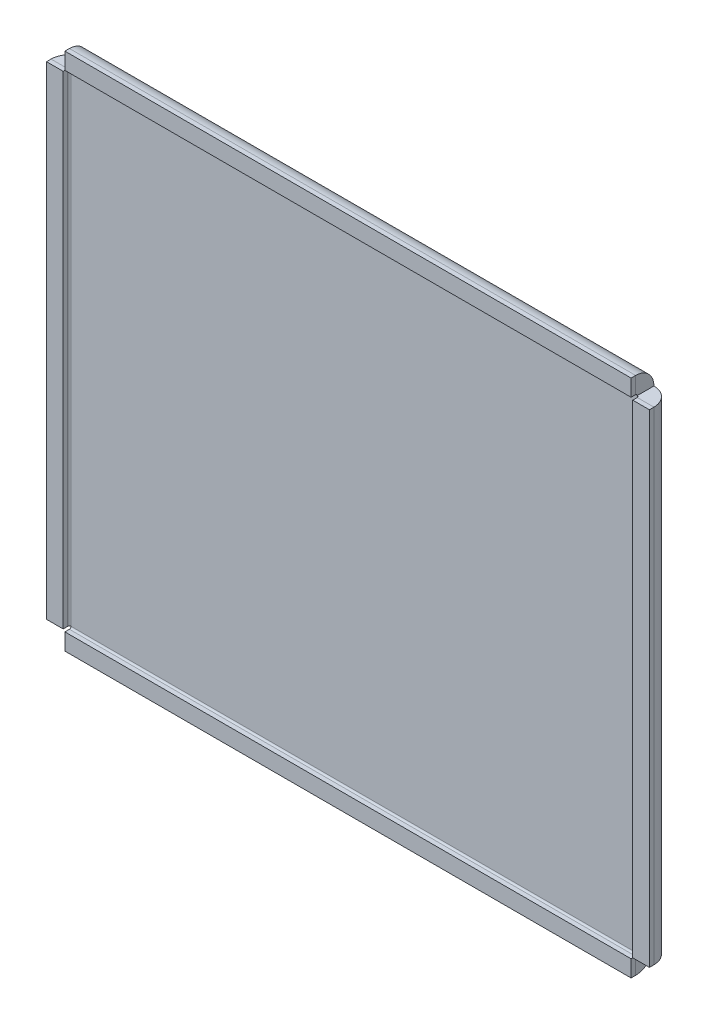
from build123d import *

# Parameters (mm, degrees)
SKETCH1_W          = 431.8
SKETCH1_H          = 368.3
BASE_FLANGE1_DEPTH = 12.7
EDGE_FLANGE1_DEPTH = 431.8
EDGE_FLANGE2_DEPTH = 431.8
EDGE_FLANGE3_DEPTH = 368.3
EDGE_FLANGE4_DEPTH = 368.3


# Sheet-metal steps are written as plain solids
with BuildPart() as part:
    # Sketch1 → Base-Flange1 (new body)
    with BuildSketch(Plane.XY):
        Rectangle(SKETCH1_W, SKETCH1_H)
    extrude(amount=BASE_FLANGE1_DEPTH)

    # Edge-Flange1 section (across the edge) → Edge-Flange1 (add)
    with BuildSketch(Plane(origin=(215.9, 185.42, 12.7), x_dir=(0, -1, 0), z_dir=(-1, 0, 0))):
        with BuildLine():
            Line((-12.7, 1.27), (-12.7, 4.7244))
            Line((-12.7, 4.7244), (0, 4.7244))
            Line((0, 4.7244), (0, 1.27))
            ThreePointArc((0, 1.27), (0.371974388, 0.371974388), (1.27, 0))
            Line((1.27, 0), (1.27, -12.7))
            ThreePointArc((1.27, -12.7), (-8.608281733, -8.608281733), (-12.7, 1.27))
        make_face()
    extrude(amount=EDGE_FLANGE1_DEPTH)

    # Edge-Flange2 section (across the edge) → Edge-Flange2 (add)
    with BuildSketch(Plane(origin=(-215.9, -185.42, 12.7), x_dir=(0, 1, 0), z_dir=(1, 0, 0))):
        with BuildLine():
            Line((-12.7, 1.27), (-12.7, 4.7244))
            Line((-12.7, 4.7244), (0, 4.7244))
            Line((0, 4.7244), (0, 1.27))
            ThreePointArc((0, 1.27), (0.371974388, 0.371974388), (1.27, 0))
            Line((1.27, 0), (1.27, -12.7))
            ThreePointArc((1.27, -12.7), (-8.608281733, -8.608281733), (-12.7, 1.27))
        make_face()
    extrude(amount=EDGE_FLANGE2_DEPTH)

    # Edge-Flange3 section (across the edge) → Edge-Flange3 (add)
    with BuildSketch(Plane(origin=(217.17, -184.15, 12.7), x_dir=(-1, 0, 0), z_dir=(0, 1, 0))):
        with BuildLine():
            Line((-12.7, 1.27), (-12.7, 4.7244))
            Line((-12.7, 4.7244), (0, 4.7244))
            Line((0, 4.7244), (0, 1.27))
            ThreePointArc((0, 1.27), (0.371974388, 0.371974388), (1.27, 0))
            Line((1.27, 0), (1.27, -12.7))
            ThreePointArc((1.27, -12.7), (-8.608281733, -8.608281733), (-12.7, 1.27))
        make_face()
    extrude(amount=EDGE_FLANGE3_DEPTH)

    # Edge-Flange4 section (across the edge) → Edge-Flange4 (add)
    with BuildSketch(Plane(origin=(-217.17, 184.15, 12.7), x_dir=(1, 0, 0), z_dir=(0, -1, 0))):
        with BuildLine():
            Line((-12.7, 1.27), (-12.7, 4.7244))
            Line((-12.7, 4.7244), (0, 4.7244))
            Line((0, 4.7244), (0, 1.27))
            ThreePointArc((0, 1.27), (0.371974388, 0.371974388), (1.27, 0))
            Line((1.27, 0), (1.27, -12.7))
            ThreePointArc((1.27, -12.7), (-8.608281733, -8.608281733), (-12.7, 1.27))
        make_face()
    extrude(amount=EDGE_FLANGE4_DEPTH)


solid = part.part
